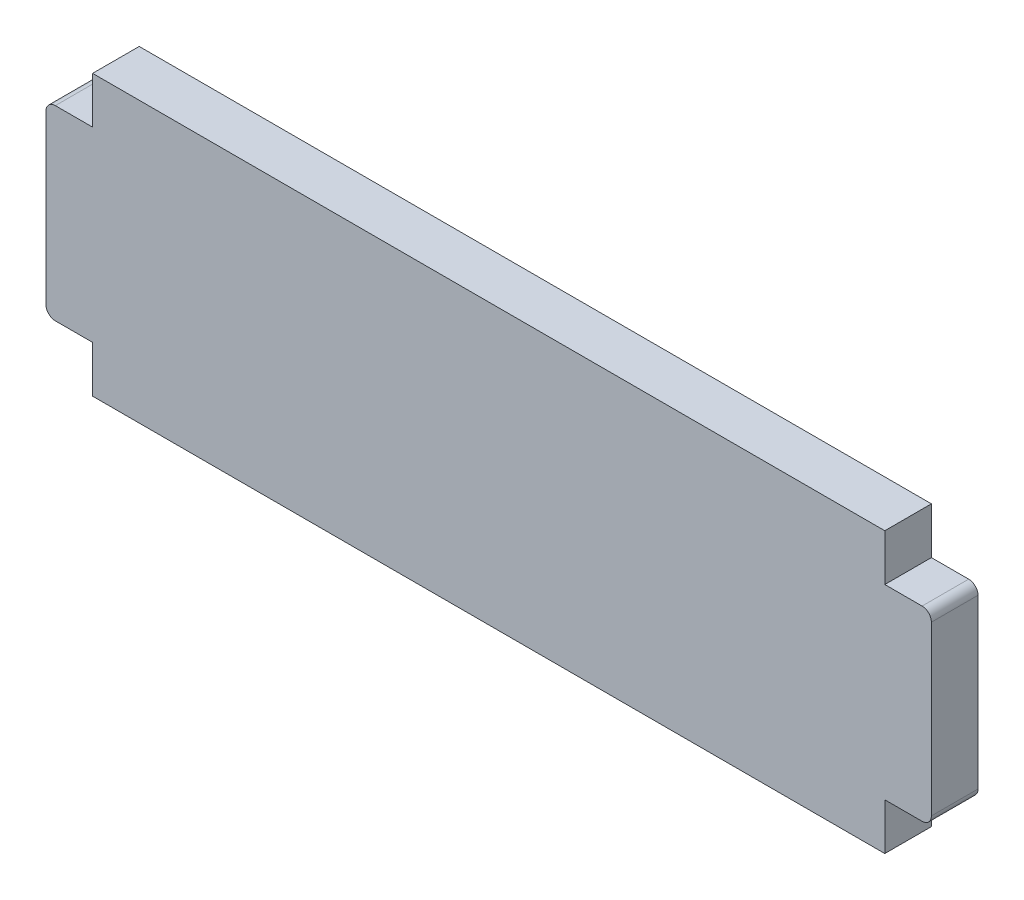
from build123d import *

# Parameters (mm, degrees)
BOSS_EXTRUDE1_DEPTH = 5
FILLET1_R           = 1


with BuildPart() as part:
    # Sketch1 → Boss-Extrude1 (new body)
    with BuildSketch(Plane.XY):
        Polygon((85, 25), (85, 30), (0, 30), (0, 25), (-5, 25), (-5, 5), (0, 5), (0, 0), (85, 0), (85, 5), (90, 5), (90, 25), align=None)
    extrude(amount=BOSS_EXTRUDE1_DEPTH)

    # Fillet1
    fillet1_edges = [part.edges().sort_by_distance(p)[0] for p in [
        (-5, 5, 2.5),
        (-5, 25, 2.5),
        (90, 5, 2.5),
        (90, 25, 2.5),
    ]]
    fillet(fillet1_edges, radius=FILLET1_R)


solid = part.part
